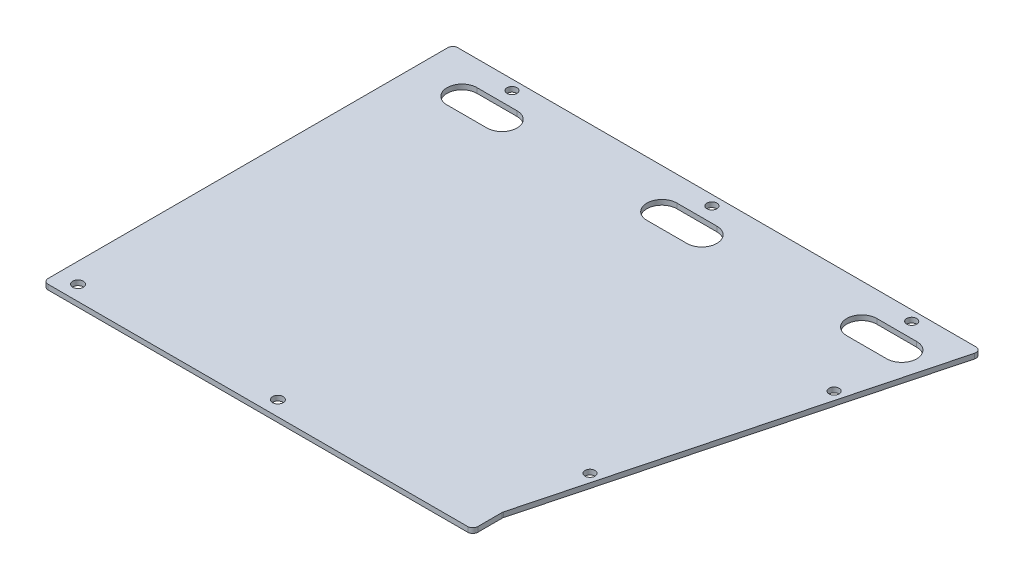
from build123d import *

# Parameters (mm, degrees)
BOSS_EXTRUDE1_DEPTH              = 3.175
FILLET1_R                        = 3.175
F_1_4_0_25_DIAMETER_HOLE1_D      = 6.35
F_17_64_0_26563_DIAMETER_HOLE1_D = 6.747002
SKETCH9_R                        = 3.175
CUT_EXTRUDE1_DEPTH               = 425.763278612


with BuildPart() as part:
    # Sketch1 → Boss-Extrude1 (new body)
    with BuildSketch(Plane(origin=(0, 0, 0), x_dir=(1, 0, 0), z_dir=(0, 1, 0))):
        Polygon((0, 0), (273.05, 0), (273.05, 19.05), (336.55, 260.35), (0, 260.35), align=None)
    extrude(amount=BOSS_EXTRUDE1_DEPTH)

    # Fillet1
    fillet1_edges = [part.edges().sort_by_distance(p)[0] for p in [
        (336.55, 1.5875, -260.35),
        (0, 1.5875, -260.35),
        (0, 1.5875, 0),
        (273.05, 1.5875, 0),
        (273.05, 1.5875, -19.05),
    ]]
    fillet(fillet1_edges, radius=FILLET1_R)

    # 1/4 (0.25) Diameter Hole1 (through all)
    with Locations(Plane(origin=(0, 3.175, 0), x_dir=(1, 0, 0), z_dir=(0, 1, 0))):
        with Locations((43.97818809, 254), (170.97818809, 254), (297.97818809, 254), (311.721536551, 190.953379927), (279.400887542, 68.134913694)):
            Hole(F_1_4_0_25_DIAMETER_HOLE1_D / 2)

    # 17/64 (0.26563) Diameter Hole1 (through all)
    with Locations(Plane(origin=(0, 3.175, 0), x_dir=(1, 0, 0), z_dir=(0, 1, 0))):
        with Locations((12.7, 9.525), (139.7, 9.525)):
            Hole(F_17_64_0_26563_DIAMETER_HOLE1_D / 2)

    # Sketch9 → Cut-Extrude1 (cut, through all)
    with BuildSketch(Plane(origin=(0, 3.175, 0), x_dir=(1, 0, 0), z_dir=(0, 1, 0))):
        with Locations((297.97818809, 254)):
            Circle(SKETCH9_R)
        with Locations((170.97818809, 254)):
            Circle(SKETCH9_R)
        with Locations((43.97818809, 254)):
            Circle(SKETCH9_R)
        with BuildLine():
            Line((31.27818809, 244.475), (56.67818809, 244.475))
            ThreePointArc((56.67818809, 244.475), (66.20318809, 234.95), (56.67818809, 225.425))
            Line((56.67818809, 225.425), (31.27818809, 225.425))
            ThreePointArc((31.27818809, 225.425), (21.75318809, 234.95), (31.27818809, 244.475))
        make_face()
        with BuildLine():
            Line((158.27818809, 244.475), (183.67818809, 244.475))
            ThreePointArc((183.67818809, 244.475), (193.20318809, 234.95), (183.67818809, 225.425))
            Line((183.67818809, 225.425), (158.27818809, 225.425))
            ThreePointArc((158.27818809, 225.425), (148.75318809, 234.95), (158.27818809, 244.475))
        make_face()
        with BuildLine():
            Line((285.27818809, 244.475), (310.67818809, 244.475))
            ThreePointArc((310.67818809, 244.475), (320.20318809, 234.95), (310.67818809, 225.425))
            Line((310.67818809, 225.425), (285.27818809, 225.425))
            ThreePointArc((285.27818809, 225.425), (275.75318809, 234.95), (285.27818809, 244.475))
        make_face()
    extrude(amount=-CUT_EXTRUDE1_DEPTH, mode=Mode.SUBTRACT)


solid = part.part
